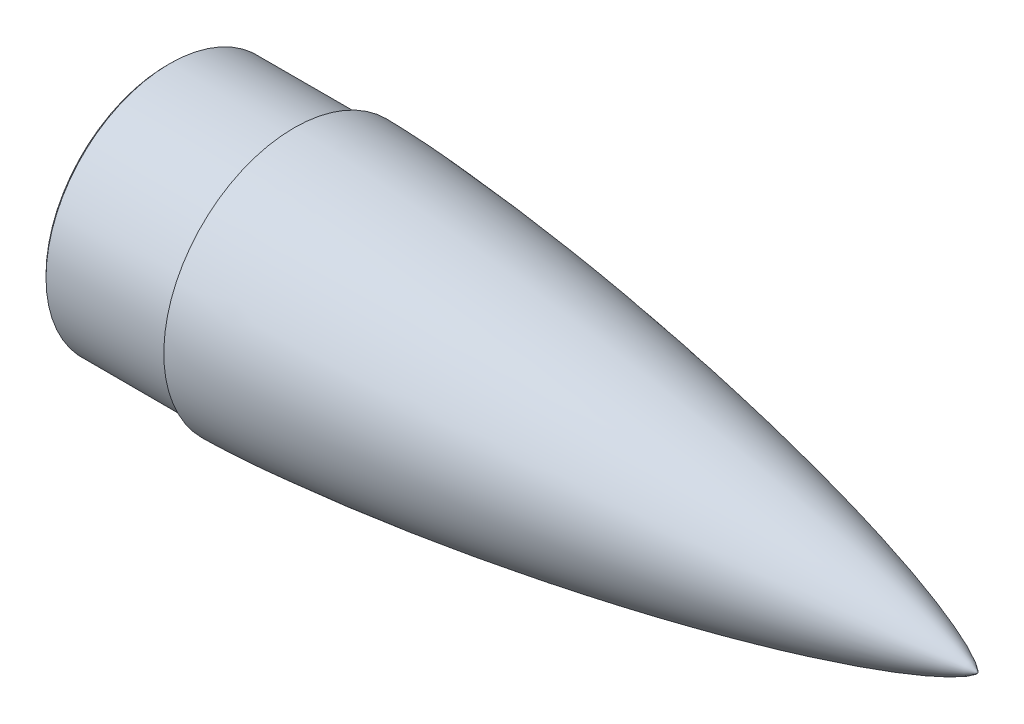
from build123d import *

# Parameters (mm, degrees)
CHAMFER1_SIZE = 1.5


with BuildPart() as part:
    # Sketch10 → Revolve1 (revolve)
    with BuildSketch(Plane.XY):
        with BuildLine():
            Line((10.583357911, 71.2), (-75.804687473, 71.2))
            Line((-75.804687473, 71.2), (-75.804687473, 74.2))
            Line((-75.804687473, 74.2), (0.395312527, 74.2))
            Line((0.395312527, 74.2), (0.395312527, 78.2))
            add(Edge.make_bspline(
                [(410.742433877, 0), (410.739805981, 0.013448374), (410.732367188, 0.039708925), (410.709765157, 0.089804421), (410.663681168, 0.172404637), (410.595574783, 0.272463885), (410.487999383, 0.410461032), (410.323375277, 0.596207829), (410.062206622, 0.858004973), (409.61769791, 1.251419248), (408.85605399, 1.845032023), (407.518960612, 2.757269807), (405.14673413, 4.167870059), (400.962341725, 6.323115614), (394.050428152, 9.402383782), (382.129455718, 14.016385051), (364.977765463, 19.732846885), (343.415398348, 26.035744456), (318.483467493, 32.522597332), (292.79825943, 38.579248249), (267.003710526, 44.150408309), (241.122105478, 49.299875089), (215.167083694, 54.065234156), (189.148471385, 58.469284758), (166.332277857, 62.015507872), (146.742958871, 64.83572622), (130.397811455, 67.036143665), (117.309635145, 68.704489528), (104.209676603, 70.277732635), (92.737112662, 71.567449507), (82.89636985, 72.60733532), (74.691044663, 73.427817715), (68.123961894, 74.055427897), (61.554067501, 74.652958094), (54.981364069, 75.218850294), (48.405867237, 75.751236616), (41.827574479, 76.247838012), (36.069117291, 76.648557995), (31.131544327, 76.965606119), (27.015724815, 77.210653392), (23.722362938, 77.394474052), (20.103639151, 77.581984585), (16.73352769, 77.740171743), (13.612218407, 77.871076921), (10.739884987, 77.976987203), (8.441678814, 78.051746207), (6.143133465, 78.115822204), (4.13161947, 78.159762908), (2.407260585, 78.188020663), (1.25759671, 78.197721464), (0.682737175, 78.201261336), (0.395312527, 78.2)],
                knots=[0, 0, 0, 0, 0, 0.000130123, 0.000260245, 0.000520491, 0.000900391, 0.00128029, 0.001925099, 0.002881508, 0.004418208, 0.006927086, 0.011110697, 0.018279138, 0.03067276, 0.051704469, 0.08310228, 0.139908797, 0.202702513, 0.265496165, 0.328289682, 0.391083359, 0.453876973, 0.516670577, 0.579464197, 0.642257765, 0.673654596, 0.705051427, 0.736448267, 0.767845106, 0.799241874, 0.814940257, 0.830638641, 0.846337073, 0.862035505, 0.877733936, 0.893432368, 0.90913072, 0.924829072, 0.932678248, 0.940527424, 0.9483766, 0.956225776, 0.967169332, 0.97264111, 0.978112888, 0.983584666, 0.989056444, 0.994528222, 0.997264111, 1, 1, 1, 1, 1], degree=4))
            Line((410.742433877, 0), (370.742433877, 0))
            add(Edge.make_bspline(
                [(370.742433877, 0), (370.740111391, 0.012274192), (370.733504164, 0.036266216), (370.713335039, 0.08212599), (370.672741876, 0.156711278), (370.613248143, 0.246496844), (370.519642703, 0.370022533), (370.375501818, 0.537560278), (370.14446322, 0.775943927), (369.749239478, 1.135547635), (369.06862773, 1.680272896), (367.874261785, 2.516435224), (365.751110244, 3.811639031), (362.023345317, 5.781116876), (355.912735531, 8.576176052), (345.42319861, 12.751969775), (330.369896232, 17.922358964), (311.462953062, 23.626384923), (289.592312364, 29.506394147), (267.054054914, 35.003458805), (244.414411613, 40.065615216), (221.693876484, 44.749520679), (198.905040813, 49.088576185), (176.056898982, 53.102972878), (156.018171872, 56.339217695), (138.811640147, 58.915696679), (124.45346338, 60.927908712), (112.955626404, 62.454810987), (101.44671438, 63.896007002), (91.366910571, 65.078725452), (82.720366502, 66.033315448), (75.510461591, 66.787206522), (69.73986898, 67.364335534), (63.9666151, 67.914292227), (58.190698781, 68.435653308), (52.412133038, 68.926716119), (46.630910453, 69.385391465), (41.570006071, 69.756118694), (37.230414075, 70.049913059), (33.612961206, 70.277362733), (30.718320781, 70.448193242), (27.560725021, 70.621523564), (24.139950244, 70.792045693), (20.949075592, 70.931353997), (17.988308992, 71.040504721), (15.520470438, 71.115648285), (13.792706229, 71.157838124), (12.311567298, 71.185699859), (11.324042887, 71.196375102), (10.830253814, 71.200548537), (10.583357911, 71.2)],
                knots=[0, 0, 0, 0, 0, 0.000134949, 0.000269899, 0.000539798, 0.000919537, 0.001299277, 0.001947431, 0.00293136, 0.004511869, 0.007081312, 0.011380263, 0.018707867, 0.031423867, 0.052705479, 0.084103008, 0.140910136, 0.203703492, 0.266497064, 0.329290816, 0.392084375, 0.454877964, 0.517671564, 0.580465191, 0.643258828, 0.674655593, 0.706052358, 0.737449114, 0.768845869, 0.800242661, 0.815941057, 0.831639453, 0.847337924, 0.863036395, 0.878734865, 0.894433336, 0.910131716, 0.925830096, 0.933679285, 0.941528475, 0.949377665, 0.957226855, 0.967920141, 0.978613427, 0.983960071, 0.989306714, 0.994653357, 0.997326678, 1, 1, 1, 1, 1], degree=4))
        make_face()
    revolve(axis=Axis((433.645840287, 0, 0), (-1, 0, 0)))

    # Chamfer1
    chamfer1_edges = [part.edges().sort_by_distance(p)[0] for p in [
        (-75.804687473, -74.2, 0),
    ]]
    chamfer(chamfer1_edges, length=CHAMFER1_SIZE)


solid = part.part
